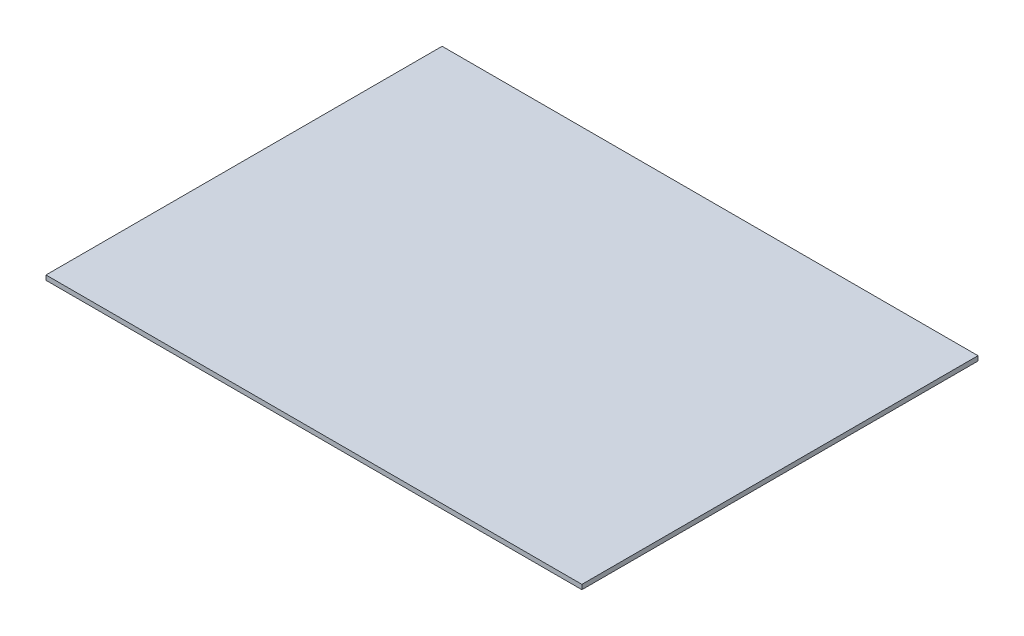
from build123d import *

# Parameters (mm, degrees)
SKETCH_1_W      = 115
SKETCH_1_H      = 85
EXTRUDE_1_DEPTH = 1


with BuildPart() as part:
    # Эскиз1 → Бобышка-Вытянуть1 (new body)
    with BuildSketch(Plane(origin=(0, 0, 0), x_dir=(1, 0, 0), z_dir=(0, 1, 0))):
        Rectangle(SKETCH_1_W, SKETCH_1_H)
    extrude(amount=EXTRUDE_1_DEPTH)


solid = part.part
